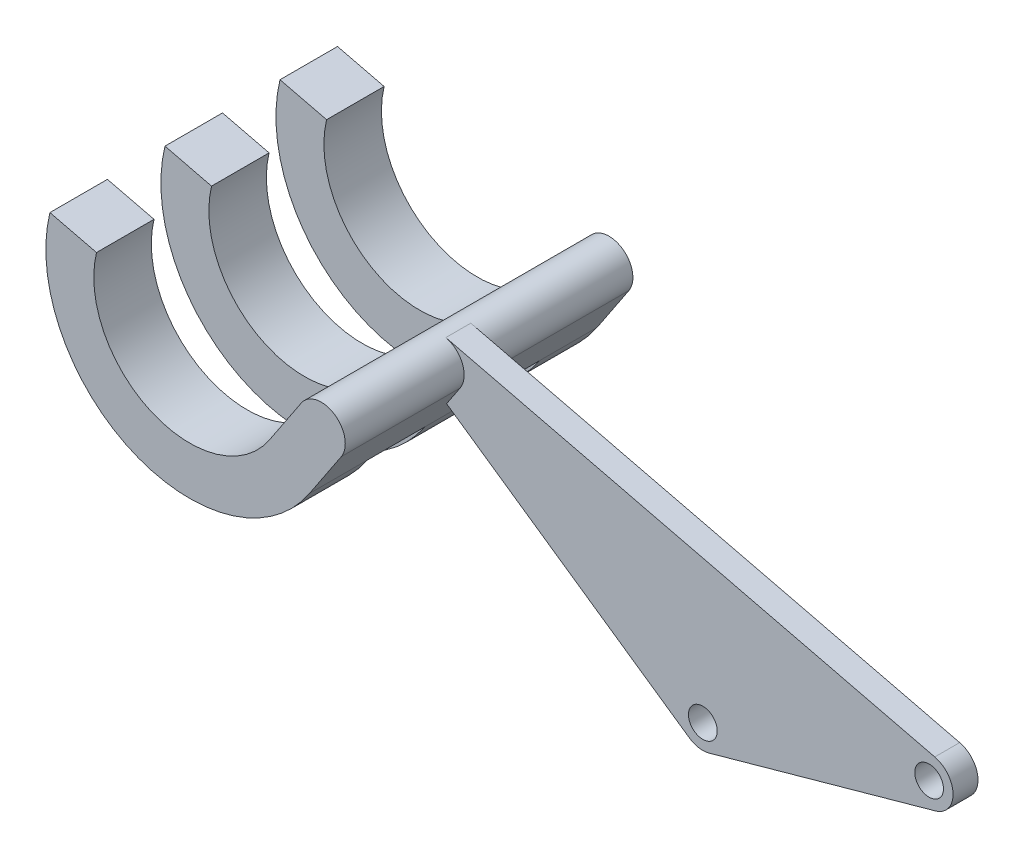
from build123d import *

# Parameters (mm, degrees)
SKETCH_1_R          = 0.75
EXTRUDE_1_DEPTH     = 0.65
EXTRUDE_2_DEPTH     = 7.5
CUT_EXTRUDE_2_DEPTH = 3
CUT_EXTRUDE_START   = -3
CUT_EXTRUDE_3_DEPTH = 3


with BuildPart() as part:
    # 草圖1 → 填料-伸長1 (new, symmetric)
    with BuildSketch(Plane.XY):
        with BuildLine():
            Line((11.036426766, 7.408103419), (36.535037211, 1.214682281))
            ThreePointArc((36.535037211, 1.214682281), (37.489824392, 0.020952098), (36.575585934, -1.204110494))
            Line((36.575585934, -1.204110494), (24.775303098, -4.492852651))
            ThreePointArc((24.775303098, -4.492852651), (24.232134741, -4.52138547), (23.728270338, -4.316527842))
            Line((23.728270338, -4.316527842), (10.029942729, 5.165635453))
            ThreePointArc((10.029942729, 5.165635453), (9.60098836, 6.705265951), (11.036426766, 7.408103419))
        make_face()
        with Locations((10.741389555, 6.193421137)):
            Circle(SKETCH_1_R, mode=Mode.SUBTRACT)
        with Locations((36.24, 0)):
            Circle(SKETCH_1_R, mode=Mode.SUBTRACT)
        with Locations((24.439717163, -3.288742157)):
            Circle(SKETCH_1_R, mode=Mode.SUBTRACT)
    extrude(amount=EXTRUDE_1_DEPTH, both=True)

    # 草圖2 → 填料-伸長2 (add, symmetric)
    with BuildSketch(Plane(origin=(0, 0, -0.65), x_dir=(-1, 0, 0), z_dir=(0, 0, -1))):
        with BuildLine():
            Line((-11.781908862, 5.500731039), (-10.119452627, 3.003484703))
            ThreePointArc((-10.119452627, 3.003484703), (-0.867443, 0.289650169), (3.411756901, 8.929848559))
            Line((3.411756901, 8.929848559), (0.982392339, 8.339774136))
            ThreePointArc((0.982392339, 8.339774136), (-1.870407595, 2.579641876), (-8.038414013, 4.388864899))
            Line((-8.038414013, 4.388864899), (-9.700870248, 6.886111236))
            ThreePointArc((-9.700870248, 6.886111236), (-11.434079653, 7.233940444), (-11.781908862, 5.500731039))
        make_face()
    extrude(amount=EXTRUDE_2_DEPTH, both=True)

    # 草圖3 → 除料-伸長2 (cut)
    with BuildSketch(Plane(origin=(0, 0, 0.85), x_dir=(-1, 0, 0), z_dir=(0, 0, -1))):
        with BuildLine():
            Line((-10.119452627, 3.003484703), (-8.038414013, 4.388864899))
            ThreePointArc((-8.038414013, 4.388864899), (-1.870407595, 2.579641876), (0.982392339, 8.339774136))
            Line((0.982392339, 8.339774136), (3.411756901, 8.929848559))
            ThreePointArc((3.411756901, 8.929848559), (-0.867443, 0.289650169), (-10.119452627, 3.003484703))
        make_face()
    extrude(amount=-CUT_EXTRUDE_2_DEPTH, mode=Mode.SUBTRACT)

    # 草圖5 → 除料-伸長3 (cut)
    with BuildSketch(Plane.XY.offset(-2.15).offset(CUT_EXTRUDE_START)):
        with BuildLine():
            Line((8.038414013, 4.388864899), (10.119452627, 3.003484703))
            ThreePointArc((10.119452627, 3.003484703), (0.867443, 0.289650169), (-3.411756901, 8.929848559))
            Line((-3.411756901, 8.929848559), (-0.982392339, 8.339774136))
            ThreePointArc((-0.982392339, 8.339774136), (1.870407595, 2.579641876), (8.038414013, 4.388864899))
        make_face()
    extrude(amount=CUT_EXTRUDE_3_DEPTH, mode=Mode.SUBTRACT)


solid = part.part
